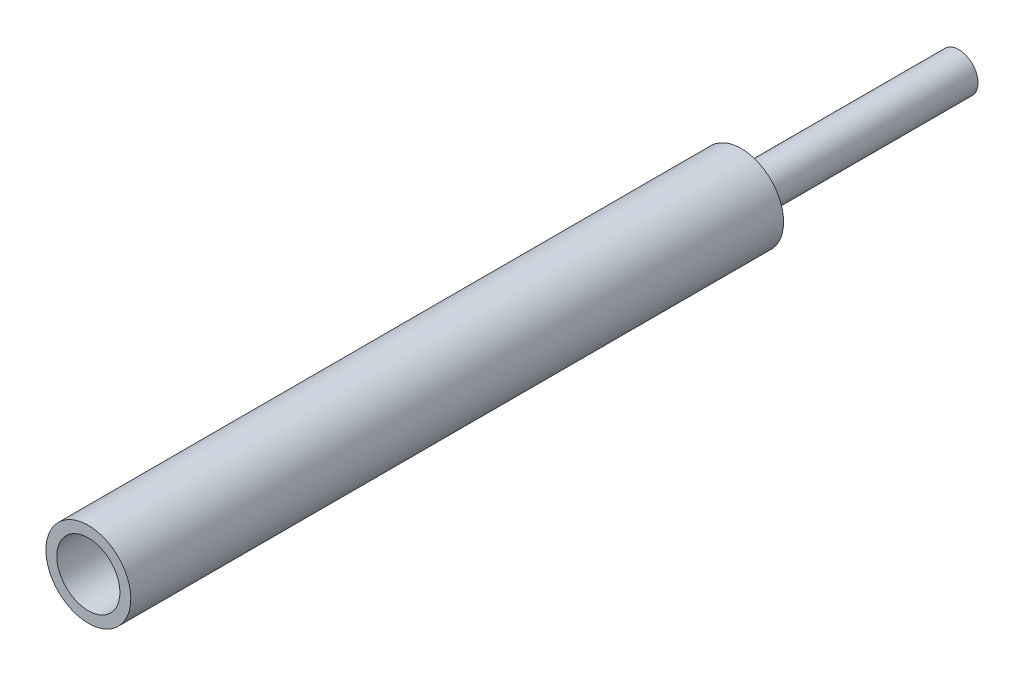
from build123d import *

# Parameters (mm, degrees)
CROQUIS1_R              = 3.9
SALIENTE_EXTRUIR1_DEPTH = 60
CROQUIS5_R              = 1.775
SALIENTE_EXTRUIR2_DEPTH = 20
CROQUIS6_R              = 2.9
CORTAR_EXTRUIR2_DEPTH   = 10


with BuildPart() as part:
    # Croquis1 → Saliente-Extruir1 (new body)
    with BuildSketch(Plane.XY):
        Circle(CROQUIS1_R)
    extrude(amount=SALIENTE_EXTRUIR1_DEPTH)

    # Croquis5 → Saliente-Extruir2 (add)
    with BuildSketch(Plane(origin=(0, 0, 0), x_dir=(-1, 0, 0), z_dir=(0, 0, -1))):
        Circle(CROQUIS5_R)
    extrude(amount=SALIENTE_EXTRUIR2_DEPTH)

    # Croquis6 → Cortar-Extruir2 (cut)
    with BuildSketch(Plane.XY.offset(60)):
        Circle(CROQUIS6_R)
    extrude(amount=-CORTAR_EXTRUIR2_DEPTH, mode=Mode.SUBTRACT)


solid = part.part
